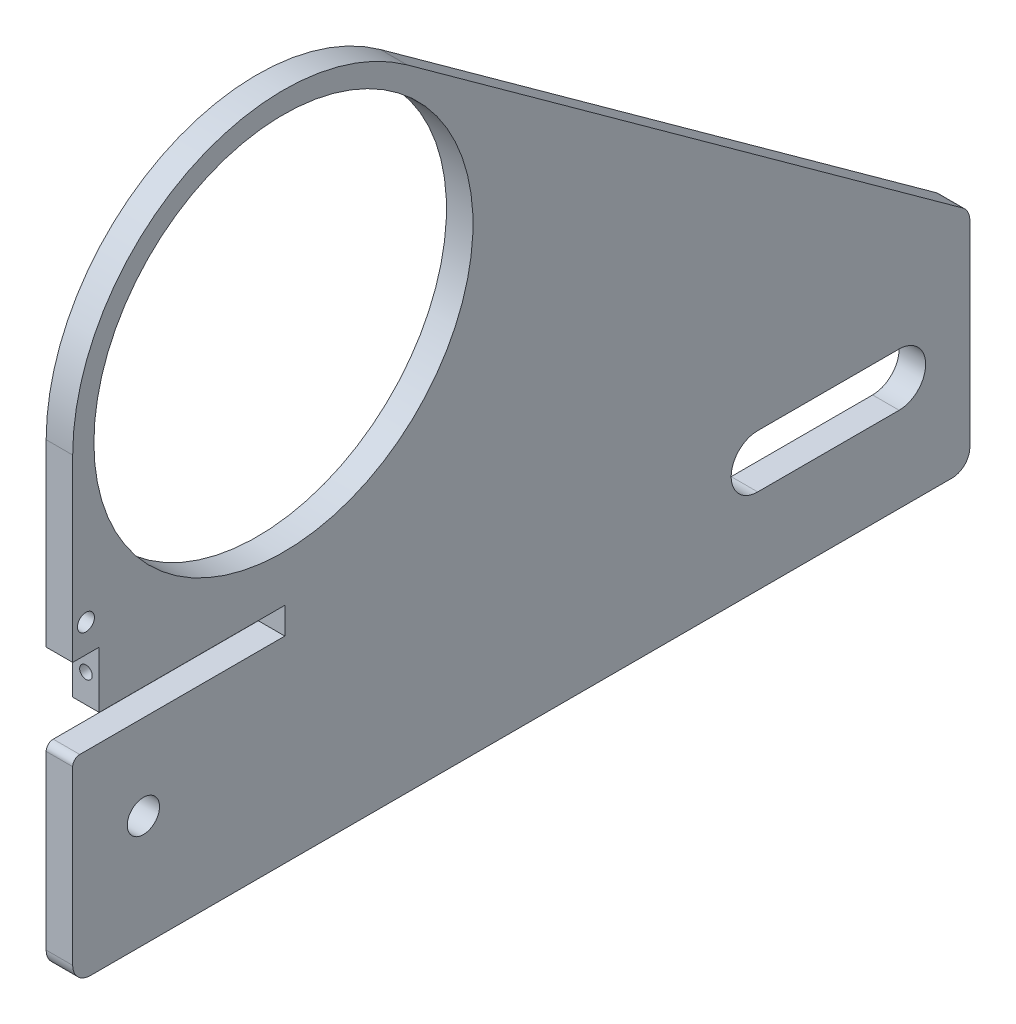
from build123d import *

# Parameters (mm, degrees)
SKETCH1_R           = 1.524
SKETCH1_R_2         = 2.8956
SKETCH1_R_3         = 34.04
BOSS_EXTRUDE1_DEPTH = 4.7625
SKETCH2_R           = 1.1303
CUT_EXTRUDE1_DEPTH  = 6.35


with BuildPart() as part:
    # Sketch1 → Boss-Extrude1 (new body)
    with BuildSketch(Plane(origin=(0, 0, 0), x_dir=(0, 0, -1), z_dir=(1, 0, 0))):
        with BuildLine():
            Line((-77.382795117, 0), (77.382795117, 0))
            ThreePointArc((77.382795117, 0), (79.627859148, 0.92993597), (80.557795117, 3.175))
            Line((80.557795117, 3.175), (80.557795117, 38.509654789))
            ThreePointArc((80.557795117, 38.509654789), (80.210081315, 39.954326985), (79.243100468, 41.082569284))
            Line((79.243100468, 41.082569284), (-20.530611645, 113.222382255))
            ThreePointArc((-20.530611645, 113.222382255), (-59.930107761, 116.254813413), (-80.557795117, 82.55))
            Line((-80.557795117, 82.55), (-80.557795117, 50.292))
            Line((-80.557795117, 50.292), (-75.795295117, 50.292))
            Line((-75.795295117, 50.292), (-75.795295117, 40.132))
            Line((-75.795295117, 40.132), (-42.457795117, 40.132))
            Line((-42.457795117, 40.132), (-42.457795117, 35.3441))
            Line((-42.457795117, 35.3441), (-79.287795117, 35.3441))
            ThreePointArc((-79.287795117, 35.3441), (-80.18582073, 34.972125612), (-80.557795117, 34.0741))
            Line((-80.557795117, 34.0741), (-80.557795117, 3.175))
            ThreePointArc((-80.557795117, 3.175), (-79.627859148, 0.92993597), (-77.382795117, 0))
        make_face()
        with Locations((-78.176545117, 55.372)):
            Circle(SKETCH1_R, mode=Mode.SUBTRACT)
        with Locations((-67.857795117, 20.066)):
            Circle(SKETCH1_R_2, mode=Mode.SUBTRACT)
        with Locations((-42.707795117, 82.55)):
            Circle(SKETCH1_R_3, mode=Mode.SUBTRACT)
        with BuildLine():
            Line((67.857795117, 15.3035), (42.457795117, 15.3035))
            ThreePointArc((42.457795117, 15.3035), (37.695295117, 20.066), (42.457795117, 24.8285))
            Line((42.457795117, 24.8285), (67.857795117, 24.8285))
            ThreePointArc((67.857795117, 24.8285), (72.620295117, 20.066), (67.857795117, 15.3035))
        make_face(mode=Mode.SUBTRACT)
    extrude(amount=BOSS_EXTRUDE1_DEPTH)

    # Sketch2 → Cut-Extrude1 (cut)
    with BuildSketch(Plane.XY.offset(75.795295117)):
        with Locations((2.38125, 45.212)):
            Circle(SKETCH2_R)
    extrude(amount=-CUT_EXTRUDE1_DEPTH, mode=Mode.SUBTRACT)


solid = part.part
